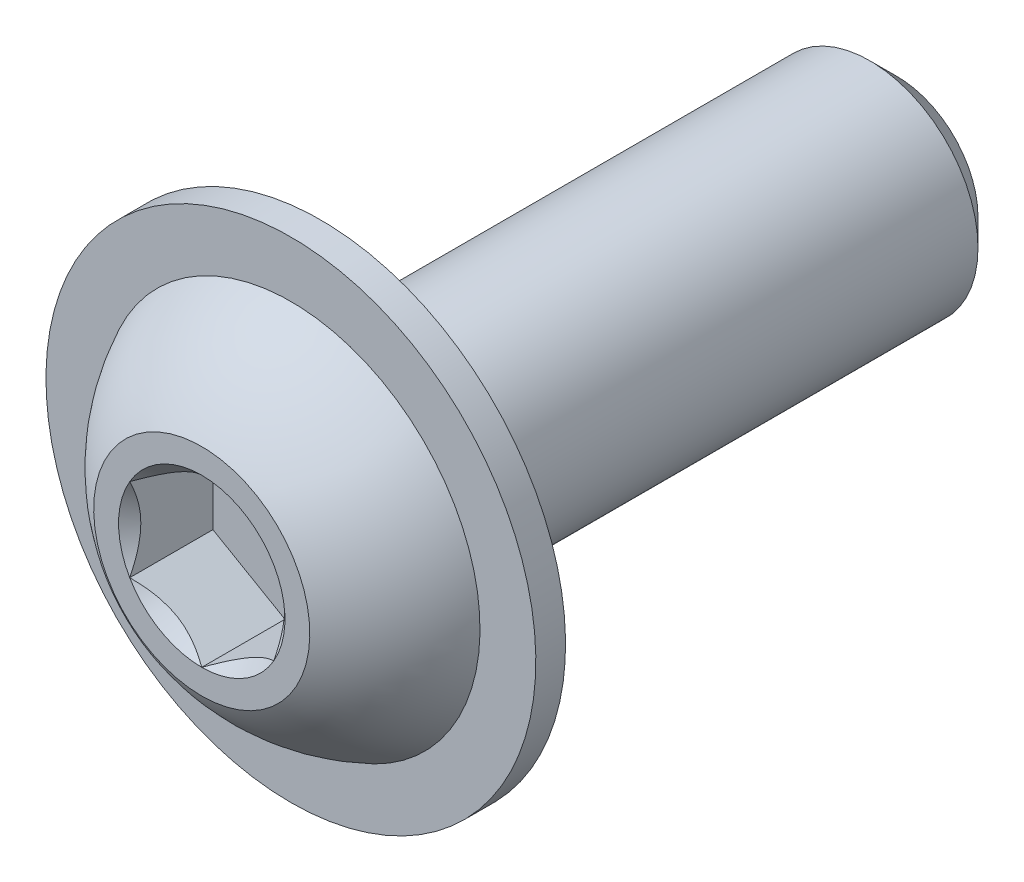
from build123d import *

# Parameters (mm, degrees)
SKETCH13_W         = 16
SKETCH13_H         = 3
CHAMFER1_SIZE      = 0.75
CUT_EXTRUDE2_DEPTH = 2.31


with BuildPart() as part:
    # Sketch13 → Revolve1 (revolve)
    with BuildSketch(Plane(origin=(0, 0, 0), x_dir=(0, 0, -1), z_dir=(1, 0, 0))):
        with Locations((1.65, 1.5)):
            Rectangle(SKETCH13_W, SKETCH13_H)
    revolve(axis=Axis((0, 0, 9.65), (0, 0, -1)))

    # Chamfer1
    chamfer1_edges = [part.edges().sort_by_distance(p)[0] for p in [
        (0, -3, -9.65),
    ]]
    chamfer(chamfer1_edges, length=CHAMFER1_SIZE)

    # Sketch7 → Revolve2 (revolve)
    with BuildSketch(Plane(origin=(0, 0, 0), x_dir=(0, 0, -1), z_dir=(1, 0, 0))):
        with BuildLine():
            Line((-6.35, 5.25), (-6.35, 0))
            Line((-6.35, 0), (-9.65, 0))
            Line((-9.65, 0), (-9.65, 3))
            ThreePointArc((-9.65, 3), (-8.577614941, 4.306626435), (-7.175, 5.25))
            Line((-7.175, 5.25), (-7.175, 6.8))
            Line((-7.175, 6.8), (-6.35, 6.8))
            Line((-6.35, 6.8), (-6.35, 5.25))
        make_face()
    revolve(axis=Axis((0, 0, 9.65), (0, 0, -1)))

    # Sketch5 → Cut-Extrude2 (cut)
    with BuildSketch(Plane.XY.offset(9.65)):
        Polygon((2, -1.154700538), (2, 1.154700538), (0, 2.309401077), (-2, 1.154700538), (-2, -1.154700538), (0, -2.309401077), align=None)
    extrude(amount=-CUT_EXTRUDE2_DEPTH, mode=Mode.SUBTRACT)

    # Cut-Extrude3 cone 1 section (through the dimple's axis) → Cut-Extrude3 (revolve, cut)
    with BuildSketch(Plane(origin=(0, 0, 9.65), x_dir=(0, -1, 0), z_dir=(1, 0, 0))):
        Polygon((0, 0), (2.309401077, 0), (0, 2.309401077), align=None)
    revolve(axis=Axis((0, 0, 9.65), (0, 0, -1)), mode=Mode.SUBTRACT)


solid = part.part
